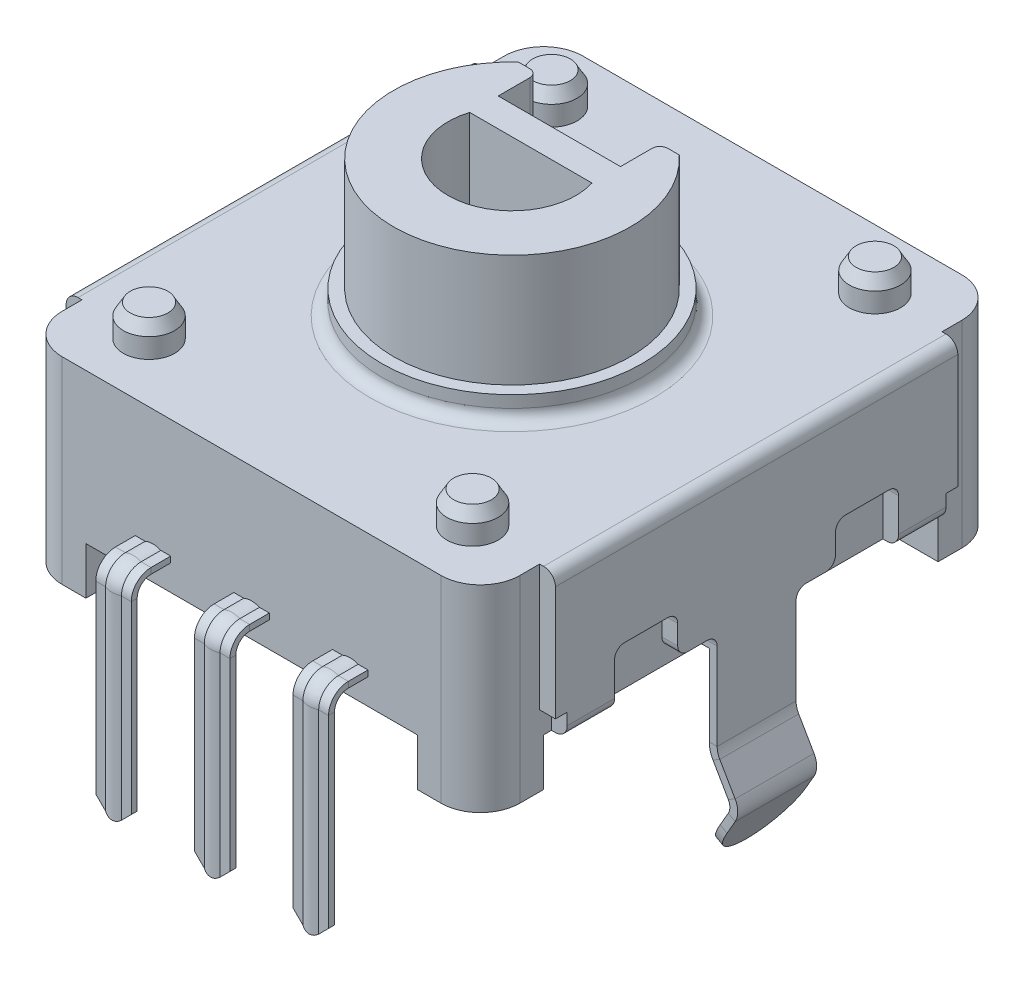
from build123d import *
from OCP.BRepFilletAPI import BRepFilletAPI_MakeChamfer

# Parameters (mm, degrees)
SKETCH1_W            = 11.6
SKETCH1_H            = 13.2
BOSS_EXTRUDE1_DEPTH  = 5
SKETCH2_R            = 3.3
BOSS_EXTRUDE2_DEPTH  = 0.6
SKETCH3_R            = 3
BOSS_EXTRUDE3_DEPTH  = 2.85
CUT_EXTRUDE1_START   = -2.65
CUT_EXTRUDE1_DEPTH   = 2.65
CUT_EXTRUDE2_DEPTH   = 1.2
SKETCH10_W           = 0.4
SKETCH10_H           = 10.2
BOSS_EXTRUDE4_DEPTH  = 3.8
SKETCH12_W           = 0.2
SKETCH12_H           = 2
CUT_EXTRUDE3_REACH   = 20.262
SKETCH14_W           = 0.3
SKETCH14_H           = 0.6
CUT_EXTRUDE4_DEPTH   = 0.4
FILLET4_R            = 0.25
FILLET4_OF_MIRROR3_R = 0.25
MIRROR6_START        = -6.2
MIRROR6_OUTLINE_W    = 0.6
MIRROR6_OUTLINE_H    = 0.3
MIRROR6_DEPTH        = 0.4
MIRROR6_START_2      = 5.8
MIRROR6_2_OUTLINE_W  = 0.6
MIRROR6_2_OUTLINE_H  = 0.3
MIRROR6_2_DEPTH      = 0.4
FILLET1_R            = 0.3
CUT_EXTRUDE5_REACH   = 19.72
LPATTERN1_COUNT      = 2
LPATTERN1_PITCH      = 2.5
LPATTERN1_COL_COUNT  = 2
LPATTERN1_COL_PITCH  = 2.5
CUT_EXTRUDE6_DEPTH   = 2.65
FILLET2_R            = 0.2
FILLET3_R            = 1
SKETCH19_R           = 0.65
BOSS_EXTRUDE5_DEPTH  = 0.8
CHAMFER1_SIZE        = 0.3
CHAMFER1_SIZE2       = 0.173205081
FILLET6_R            = 0.3


# Read off the part's stored shape, not the designer's step: Mirror6
with BuildPart() as part:
    # Sketch1 → Boss-Extrude1 (new body)
    with BuildSketch(Plane(origin=(0, 0, 0), x_dir=(1, 0, 0), z_dir=(0, 1, 0))):
        Rectangle(SKETCH1_W, SKETCH1_H)
    extrude(amount=BOSS_EXTRUDE1_DEPTH)

    # Sketch2 → Boss-Extrude2 (add)
    with BuildSketch(Plane(origin=(0, 5, 0), x_dir=(1, 0, 0), z_dir=(0, 1, 0))):
        with Locations(Location((0, 0, 0), (0, 0, 270))):
            Circle(SKETCH2_R)
    extrude(amount=BOSS_EXTRUDE2_DEPTH)

    # Sketch3 → Boss-Extrude3 (add)
    with BuildSketch(Plane(origin=(0, 5.6, 0), x_dir=(1, 0, 0), z_dir=(0, 1, 0))):
        with Locations(Location((0, 0, 0), (0, 0, 270))):
            Circle(SKETCH3_R)
    extrude(amount=BOSS_EXTRUDE3_DEPTH)

    # Sketch4 → Cut-Extrude1 (cut)
    with BuildSketch(Plane(origin=(0, 8.45, 0), x_dir=(1, 0, 0), z_dir=(0, 1, 0)).offset(CUT_EXTRUDE1_START)):
        with BuildLine():
            Line((-2.039607805, 2.2), (-1.55, 2.2))
            Line((-1.55, 2.2), (-1.55, 1.2))
            Line((-1.55, 1.2), (1.55, 1.2))
            Line((1.55, 1.2), (1.55, 2.2))
            Line((1.55, 2.2), (2.039607805, 2.2))
            ThreePointArc((2.039607805, 2.2), (0, 3), (-2.039607805, 2.2))
        make_face()
    extrude(amount=CUT_EXTRUDE1_DEPTH, mode=Mode.SUBTRACT)

    # Sketch5 → Cut-Extrude2 (cut)
    with BuildSketch(Plane.XZ):
        Polygon((-5.8, 5), (-4.2, 5), (-4.2, 6.6), (4.2, 6.6), (4.2, 5), (5.8, 5), (5.8, -5), (4.2, -5), (4.2, -6.6), (-4.2, -6.6), (-4.2, -5), (-5.8, -5), align=None)
    extrude(amount=-CUT_EXTRUDE2_DEPTH, mode=Mode.SUBTRACT)

    # Sketch10 → Boss-Extrude4 (add)
    with BuildSketch(Plane(origin=(0, 5, 0), x_dir=(1, 0, 0), z_dir=(0, 1, 0))):
        with Locations((-6, 0)):
            Rectangle(SKETCH10_W, SKETCH10_H)
    boss_extrude4 = extrude(amount=-BOSS_EXTRUDE4_DEPTH)

    # Mirror1: Boss-Extrude4 across plane
    add(boss_extrude4.mirror(Plane(origin=(0, 0, 0), x_dir=(0, 0, 1), z_dir=(1, 0, 0))))

    # Sweep1: sweep along a path in Sketch11
    with BuildLine(Plane.XY) as sweep1_path:
        Line((-6.2, 1.2), (-6.2, -0.854551733))
        ThreePointArc((-6.2, -0.854551733), (-6.217037087, -0.983961255), (-6.266987298, -1.104551733))
        Line((-6.266987298, -1.104551733), (-6.655662433, -1.777756814))
        ThreePointArc((-6.655662433, -1.777756814), (-6.722649731, -2.027756814), (-6.655662433, -2.277756814))
        Line((-6.655662433, -2.277756814), (-5.95, -3.5))
    # Sketch12 → Sweep1 (sweep)
    with BuildSketch(Plane.XZ.offset(-1.2)):
        with Locations((-6.1, 0)):
            Rectangle(SKETCH12_W, SKETCH12_H)
    sweep1 = sweep(path=sweep1_path.line)

    # Sketch13 → Cut-Extrude3 (cut, up to next)
    with BuildSketch(Plane(origin=(-5.978044457, -3.451425576, 0), x_dir=(0, 0, 1), z_dir=(-0.866025403784438, -0.500000000000001, 0)), mode=Mode.PRIVATE) as cut_extrude3_sk1:
        with BuildLine():
            ThreePointArc((0, -0.056088913), (-0.707106781, 0.236804306), (-1, 0.943911087))
            Line((-1, 0.943911087), (-1, -0.056088913))
            Line((-1, -0.056088913), (0, -0.056088913))
        make_face()
    cut_extrude3_tool1 = extrude(cut_extrude3_sk1.sketch, amount=-CUT_EXTRUDE3_REACH, mode=Mode.PRIVATE) & part.part
    # Sketch13 → Cut-Extrude3 (cut, up to next)
    with BuildSketch(Plane(origin=(-5.978044457, -3.451425576, 0), x_dir=(0, 0, 1), z_dir=(-0.866025403784438, -0.500000000000001, 0)), mode=Mode.PRIVATE) as cut_extrude3_sk2:
        with BuildLine():
            ThreePointArc((1, 0.943911087), (0.707106781, 0.236804306), (0, -0.056088913))
            Line((0, -0.056088913), (1, -0.056088913))
            Line((1, -0.056088913), (1, 0.943911087))
        make_face()
    cut_extrude3_tool2 = extrude(cut_extrude3_sk2.sketch, amount=-CUT_EXTRUDE3_REACH, mode=Mode.PRIVATE) & part.part
    cut_extrude3_1 = cut_extrude3_tool1.solids().sort_by_distance((-6.061684, -3.306558, -0.776632))[0]
    add(cut_extrude3_1, mode=Mode.SUBTRACT)
    cut_extrude3_2 = cut_extrude3_tool2.solids().sort_by_distance((-6.061684, -3.306558, 0.776632))[0]
    add(cut_extrude3_2, mode=Mode.SUBTRACT)
    cut_extrude3 = cut_extrude3_1 + cut_extrude3_2  # Cut-Extrude3 as one shape, for the pattern or mirror that repeats it

    # Mirror2: Sweep1, Cut-Extrude3 across plane
    add(sweep1.mirror(Plane(origin=(0, 0, 0), x_dir=(0, 0, 1), z_dir=(1, 0, 0))))
    add(cut_extrude3.mirror(Plane(origin=(0, 0, 0), x_dir=(0, 0, 1), z_dir=(1, 0, 0))), mode=Mode.SUBTRACT)

    # Sketch14 → Cut-Extrude4 (cut)
    with BuildSketch(Plane.ZY.offset(6.2)):
        with Locations((-4.95, 1.5)):
            Rectangle(SKETCH14_W, SKETCH14_H)
        Polygon((-3.6, 1.2), (-3.6, 2.6), (-2, 2.6), (-2, 1.6), (-1, 1.6), (-1, 1.2), align=None)
    cut_extrude4 = extrude(amount=-CUT_EXTRUDE4_DEPTH, mode=Mode.SUBTRACT)

    # Fillet4
    fillet4_edges = [part.edges().sort_by_distance(p)[0] for p in [
        (-6, 2.6, -3.6),
        (-6, 2.6, -2),
        (-6, 1.6, -2),
        (-6, 1.6, -1),
    ]]
    fillet(fillet4_edges, radius=FILLET4_R)

    # Mirror3: Cut-Extrude4 across plane
    add(cut_extrude4.mirror(Plane(origin=(0, 0, 0), x_dir=(0, 0, 1), z_dir=(1, 0, 0))), mode=Mode.SUBTRACT)

    # Fillet4 of Mirror3
    fillet4_of_mirror3_edges = [part.edges().sort_by_distance(p)[0] for p in [
        (6, 2.6, -3.6),
        (6, 2.6, -2),
        (6, 1.6, -2),
        (6, 1.6, -1),
    ]]
    fillet(fillet4_of_mirror3_edges, radius=FILLET4_OF_MIRROR3_R)

    # Mirror6 outline → Mirror6 (cut)
    with BuildSketch(Plane.YZ.offset(MIRROR6_START)):
        with Locations((1.5, 4.95)):
            Rectangle(MIRROR6_OUTLINE_W, MIRROR6_OUTLINE_H)
        with BuildLine():
            Line((1.2, 1), (1.35, 1))
            ThreePointArc((1.35, 1), (1.526776695, 1.073223305), (1.6, 1.25))
            Line((1.6, 1.25), (1.6, 1.75))
            ThreePointArc((1.6, 1.75), (1.673223305, 1.926776695), (1.85, 2))
            Line((1.85, 2), (2.35, 2))
            ThreePointArc((2.35, 2), (2.526776695, 2.073223305), (2.6, 2.25))
            Line((2.6, 2.25), (2.6, 3.35))
            ThreePointArc((2.6, 3.35), (2.526776695, 3.526776695), (2.35, 3.6))
            Line((2.35, 3.6), (1.2, 3.6))
            Line((1.2, 3.6), (1.2, 1))
        make_face()
    extrude(amount=MIRROR6_DEPTH, mode=Mode.SUBTRACT)

    # Mirror6 2 outline → Mirror6 2 (cut)
    with BuildSketch(Plane.YZ.offset(MIRROR6_START_2)):
        with Locations((1.5, 4.95)):
            Rectangle(MIRROR6_2_OUTLINE_W, MIRROR6_2_OUTLINE_H)
        with BuildLine():
            Line((1.2, 1), (1.35, 1))
            ThreePointArc((1.35, 1), (1.526776695, 1.073223305), (1.6, 1.25))
            Line((1.6, 1.25), (1.6, 1.75))
            ThreePointArc((1.6, 1.75), (1.673223305, 1.926776695), (1.85, 2))
            Line((1.85, 2), (2.35, 2))
            ThreePointArc((2.35, 2), (2.526776695, 2.073223305), (2.6, 2.25))
            Line((2.6, 2.25), (2.6, 3.35))
            ThreePointArc((2.6, 3.35), (2.526776695, 3.526776695), (2.35, 3.6))
            Line((2.35, 3.6), (1.2, 3.6))
            Line((1.2, 3.6), (1.2, 1))
        make_face()
    extrude(amount=MIRROR6_2_DEPTH, mode=Mode.SUBTRACT)

    # Fillet1
    fillet1_edges = [part.edges().sort_by_distance(p)[0] for p in [
        (-6.2, 1.2, -4.2),
        (6.2, 1.2, -4.2),
        (6.2, 1.2, 4.2),
        (-6.2, 1.2, 4.2),
        (-6.2, 5, 0),
        (6.2, 5, 0),
    ]]
    fillet(fillet1_edges, radius=FILLET1_R)

    # Sweep2: sweep along a path in Sketch15
    with BuildLine(Plane(origin=(0, 0, 0), x_dir=(0, 0, -1), z_dir=(1, 0, 0))) as sweep2_path:
        Line((-6.6, 2), (-7.1, 2))
        ThreePointArc((-7.1, 2), (-7.453553391, 1.853553391), (-7.6, 1.5))
        Line((-7.6, 1.5), (-7.6, -3.5))
    # Sketch16 → Sweep2 (sweep)
    with BuildSketch(Plane.XY.offset(6.6)):
        with BuildLine():
            Line((-0.45, 2), (-0.2, 2))
            ThreePointArc((-0.2, 2), (0, 2.041742431), (0.2, 2))
            Line((0.2, 2), (0.45, 2))
            Line((0.45, 2), (0.45, 1.85))
            Line((0.45, 1.85), (-0.45, 1.85))
            Line((-0.45, 1.85), (-0.45, 2))
        make_face()
    sweep2 = sweep(path=sweep2_path.line)

    # Sketch17 → Cut-Extrude5 (cut, up to next)
    with BuildSketch(Plane(origin=(0, 0, 7.45), x_dir=(-1, 0, 0), z_dir=(0, 0, -1)), mode=Mode.PRIVATE) as cut_extrude5_sk1:
        with BuildLine():
            ThreePointArc((0.212132034, -3.412132034), (0.11480503, -3.47716386), (0, -3.5))
            Line((0, -3.5), (0.45, -3.5))
            Line((0.45, -3.5), (0.45, -3.174264069))
            Line((0.45, -3.174264069), (0.212132034, -3.412132034))
        make_face()
    cut_extrude5_tool1 = extrude(cut_extrude5_sk1.sketch, amount=-CUT_EXTRUDE5_REACH, mode=Mode.PRIVATE) & part.part
    # Sketch17 → Cut-Extrude5 (cut, up to next)
    with BuildSketch(Plane(origin=(0, 0, 7.45), x_dir=(-1, 0, 0), z_dir=(0, 0, -1)), mode=Mode.PRIVATE) as cut_extrude5_sk2:
        with BuildLine():
            Line((-0.212132034, -3.412132034), (-0.45, -3.174264069))
            Line((-0.45, -3.174264069), (-0.45, -3.5))
            Line((-0.45, -3.5), (0, -3.5))
            ThreePointArc((0, -3.5), (-0.11480503, -3.47716386), (-0.212132034, -3.412132034))
        make_face()
    cut_extrude5_tool2 = extrude(cut_extrude5_sk2.sketch, amount=-CUT_EXTRUDE5_REACH, mode=Mode.PRIVATE) & part.part
    cut_extrude5_1 = cut_extrude5_tool1.solids().sort_by_distance((-0.333511, -3.394609, 7.45))[0]
    add(cut_extrude5_1, mode=Mode.SUBTRACT)
    cut_extrude5_2 = cut_extrude5_tool2.solids().sort_by_distance((0.333511, -3.394609, 7.45))[0]
    add(cut_extrude5_2, mode=Mode.SUBTRACT)
    cut_extrude5 = cut_extrude5_1 + cut_extrude5_2  # Cut-Extrude5 as one shape, for the pattern or mirror that repeats it

    # LPattern1: Sweep2, Cut-Extrude5 ×2
    with Locations(*[(i * LPATTERN1_PITCH, 0, 0) for i in range(1, LPATTERN1_COUNT)]):
        add(sweep2)
        add(cut_extrude5, mode=Mode.SUBTRACT)

    # LPattern1 col: Sweep2, Cut-Extrude5 ×2
    with Locations(*[(-i * LPATTERN1_COL_PITCH, 0, 0) for i in range(1, LPATTERN1_COL_COUNT)]):
        add(sweep2)
        add(cut_extrude5, mode=Mode.SUBTRACT)

    # Sketch18 → Cut-Extrude6 (cut)
    with BuildSketch(Plane(origin=(0, 8.45, 0), x_dir=(1, 0, 0), z_dir=(0, 1, 0))):
        with BuildLine():
            Line((-1.55, 0.47797619), (1.55, 0.47797619))
            ThreePointArc((1.55, 0.47797619), (0, -1.62202381), (-1.55, 0.47797619))
        make_face()
    extrude(amount=-CUT_EXTRUDE6_DEPTH, mode=Mode.SUBTRACT)

    # Fillet2
    fillet2_edges = [part.edges().sort_by_distance(p)[0] for p in [
        (1.55, 7.125, -2.2),
        (-1.55, 7.125, -2.2),
    ]]
    fillet(fillet2_edges, radius=FILLET2_R)

    # Fillet3
    fillet3_edges = [part.edges().sort_by_distance(p)[0] for p in [
        (-5.8, 2.5, -6.6),
        (5.8, 2.5, -6.6),
        (5.8, 2.5, 6.6),
        (-5.8, 2.5, 6.6),
    ]]
    fillet(fillet3_edges, radius=FILLET3_R)

    # Sketch19 → Boss-Extrude5 (add)
    with BuildSketch(Plane(origin=(0, 5, 0), x_dir=(1, 0, 0), z_dir=(0, 1, 0))):
        with Locations(Location((-4.1, 5.1, 0), (0, 0, 270))):
            Circle(SKETCH19_R)
        with Locations(Location((4.1, 5.1, 0), (0, 0, 270))):
            Circle(SKETCH19_R)
        with Locations(Location((4.1, -5.1, 0), (0, 0, 270))):
            Circle(SKETCH19_R)
        with Locations(Location((-4.1, -5.1, 0), (0, 0, 270))):
            Circle(SKETCH19_R)
    extrude(amount=BOSS_EXTRUDE5_DEPTH)

    # Chamfer1: one chamfer whose edges measure the first distance from different faces: ONE call of the kernel's chamfer builder (chamfer() names one face for all edges)
    chamfer1_edges_1 = [part.edges().sort_by_distance(p)[0] for p in [
        (-4.1, 5.8, -5.75),
    ]]
    chamfer1_side_1 = [part.faces().sort_by_distance(p)[0] for p in [
        (-4.1, 5.4, -5.75),
    ]]
    chamfer1_edges_2 = [part.edges().sort_by_distance(p)[0] for p in [
        (4.1, 5.8, -5.75),
    ]]
    chamfer1_side_2 = [part.faces().sort_by_distance(p)[0] for p in [
        (4.1, 5.4, -5.75),
    ]]
    chamfer1_edges_3 = [part.edges().sort_by_distance(p)[0] for p in [
        (4.1, 5.8, 4.45),
    ]]
    chamfer1_side_3 = [part.faces().sort_by_distance(p)[0] for p in [
        (4.1, 5.4, 4.45),
    ]]
    chamfer1_edges_4 = [part.edges().sort_by_distance(p)[0] for p in [
        (-4.1, 5.8, 4.45),
    ]]
    chamfer1_side_4 = [part.faces().sort_by_distance(p)[0] for p in [
        (-4.1, 5.4, 4.45),
    ]]
    chamfer1 = BRepFilletAPI_MakeChamfer(part.part.solid().wrapped)
    for e in chamfer1_edges_1:
        chamfer1.Add(CHAMFER1_SIZE, CHAMFER1_SIZE2, e.wrapped, chamfer1_side_1[0].wrapped)  # the first distance lies on this face
    for e in chamfer1_edges_2:
        chamfer1.Add(CHAMFER1_SIZE, CHAMFER1_SIZE2, e.wrapped, chamfer1_side_2[0].wrapped)  # the first distance lies on this face
    for e in chamfer1_edges_3:
        chamfer1.Add(CHAMFER1_SIZE, CHAMFER1_SIZE2, e.wrapped, chamfer1_side_3[0].wrapped)  # the first distance lies on this face
    for e in chamfer1_edges_4:
        chamfer1.Add(CHAMFER1_SIZE, CHAMFER1_SIZE2, e.wrapped, chamfer1_side_4[0].wrapped)  # the first distance lies on this face
    add(Compound.cast(chamfer1.Shape()), mode=Mode.REPLACE)

    # Fillet6
    fillet6_edges = [part.edges().sort_by_distance(p)[0] for p in [
        (0, 5, -3.3),
    ]]
    fillet(fillet6_edges, radius=FILLET6_R)


solid = part.part
